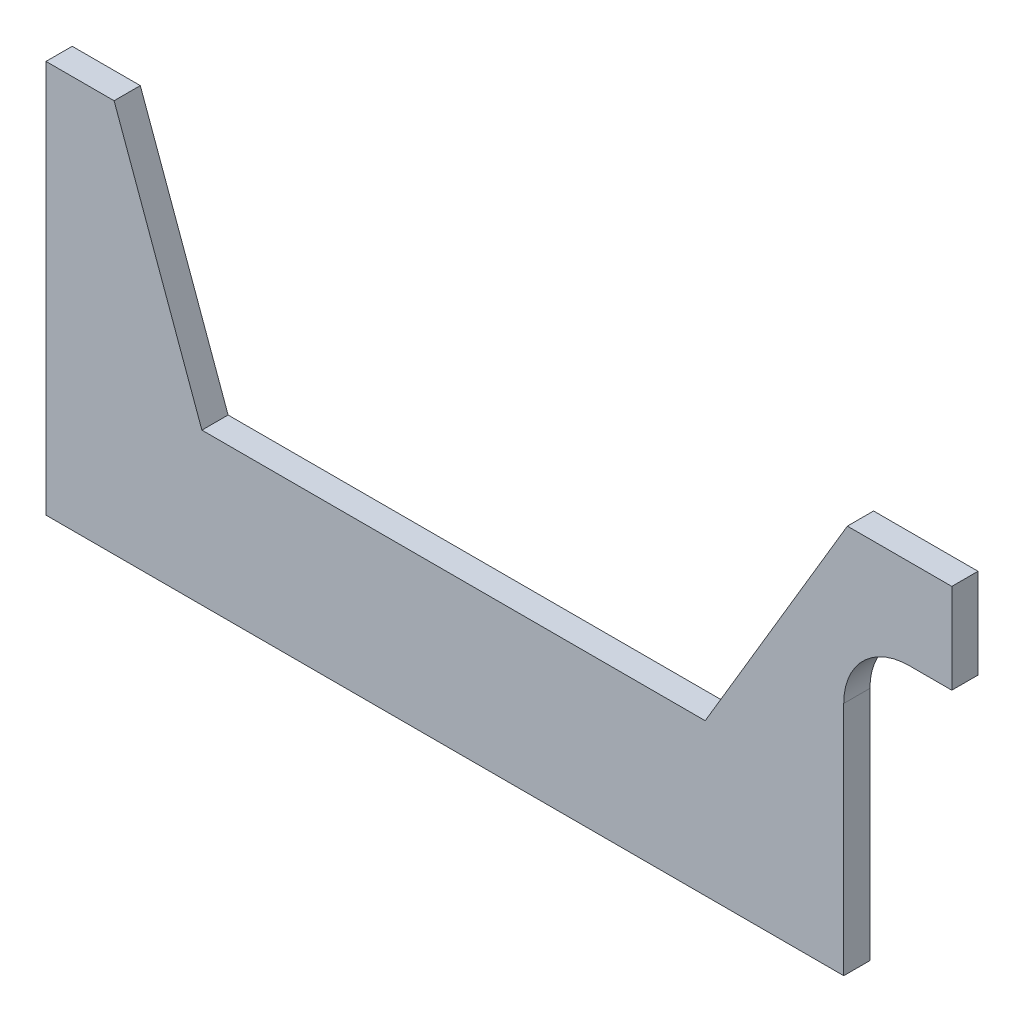
from build123d import *

# Parameters (mm, degrees)
BOSS_EXTRUDE1_DEPTH = 2
FILLET1_R           = 10


with BuildPart() as part:
    # Sketch1 → Boss-Extrude1 (new, symmetric)
    with BuildSketch(Plane.XY):
        Polygon((-60.75, -30), (-60.75, 30), (-50.352877454, 30), (-36.945370579, -6.855179418), (39.897088693, -6.855179418), (61.606830496, 29.73214036), (77.549740604, 29.73214036), (77.549740604, 16), (61.049740604, 16), (61.049740604, -30), align=None)
    extrude(amount=BOSS_EXTRUDE1_DEPTH, both=True)

    # Fillet1
    fillet1_edges = [part.edges().sort_by_distance(p)[0] for p in [
        (61.049740604, 16, 0),
    ]]
    fillet(fillet1_edges, radius=FILLET1_R)


solid = part.part
